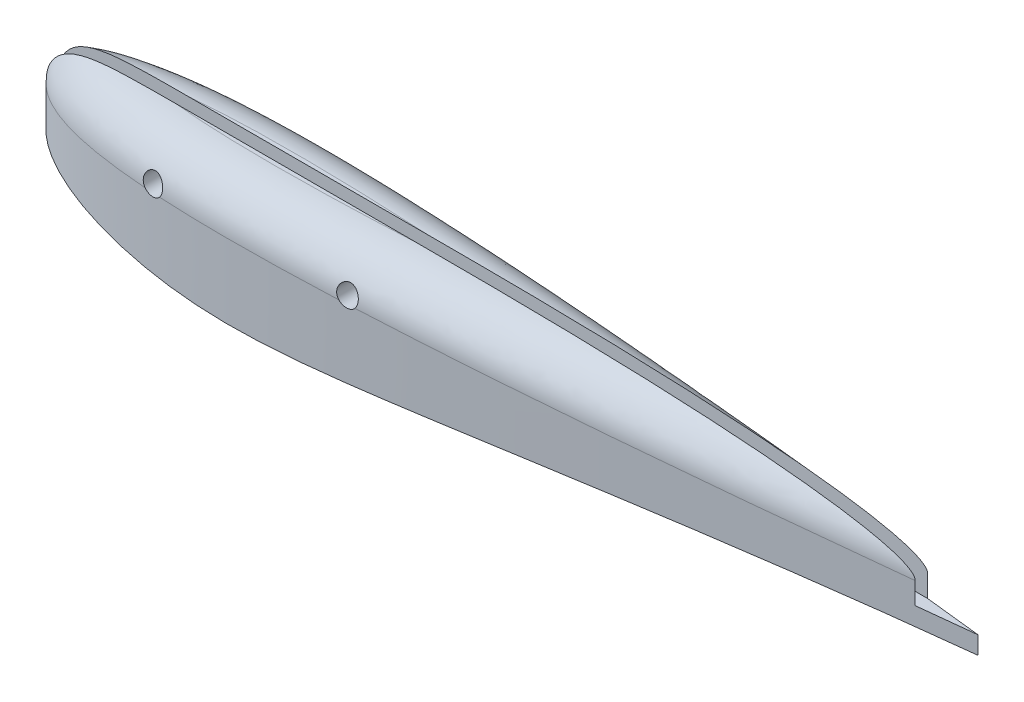
from build123d import *

# Parameters (mm, degrees)
BOSS_EXTRUDE1_DEPTH     = 20
CUT_EXTRUDE1_DEPTH      = 100
CUT_EXTRUDE1_DEPTH_BACK = 80
SKETCH2_R               = 9.525
FILLET1_R               = 7
CUT_EXTRUDE2_DEPTH      = 90
CUT_EXTRUDE2_DEPTH_BACK = 80
SKETCH3_W               = 2
SKETCH3_H               = 21
SKETCH4_R               = 1.1
CUT_EXTRUDE3_DEPTH      = 80
SKETCH5_R               = 1.65
CUT_EXTRUDE4_DEPTH      = 10


with BuildPart() as part:
    # Sketch1 → Boss-Extrude1 (new body)
    with BuildSketch(Plane(origin=(0, 0, 0), x_dir=(1, 0, 0), z_dir=(0, 1, 0))):
        with BuildLine():
            add(Edge.make_bspline(
                [(-69.417288603, 0), (-64.102368137, 8.438871324), (-45.488700864, 11.50648449), (-0.596238351, 9), (80.582711397, 0)],
                knots=[0, 0, 0, 0, 0, 1, 1, 1, 1, 1], degree=4))
            add(Edge.make_bspline(
                [(-69.417288603, 0), (-64.102368137, -8.438871324), (-45.488700864, -11.50648449), (-0.596238351, -9), (80.582711397, 0)],
                knots=[0, 0, 0, 0, 0, 1, 1, 1, 1, 1], degree=4))
        make_face()
    extrude(amount=BOSS_EXTRUDE1_DEPTH)

    # Sketch2 → Cut-Extrude1 (cut, two sides: drawn at the far end of the back side and taken through both)
    with BuildSketch(Plane(origin=(0, 0, 0), x_dir=(0, 0, -1), z_dir=(1, 0, 0)).offset(-CUT_EXTRUDE1_DEPTH_BACK)):
        with Locations((0, -2.900256299)):
            Circle(SKETCH2_R)
    extrude(amount=CUT_EXTRUDE1_DEPTH + CUT_EXTRUDE1_DEPTH_BACK, mode=Mode.SUBTRACT)

    # Fillet1
    fillet1_edges = [part.edges().sort_by_distance(p)[0] for p in [
        (4.643573397, 20, -7.185019948),
        (4.643573397, 20, 7.185019948),
    ]]
    fillet(fillet1_edges, radius=FILLET1_R)

    # Sketch3 → Cut-Extrude2 (cut, two sides: drawn at the far end of the back side and taken through both)
    with BuildSketch(Plane(origin=(0, 0, 0), x_dir=(0, 0, -1), z_dir=(1, 0, 0)).offset(-CUT_EXTRUDE2_DEPTH_BACK)):
        with Locations((0, 20)):
            Rectangle(SKETCH3_W, SKETCH3_H)
    extrude(amount=CUT_EXTRUDE2_DEPTH + CUT_EXTRUDE2_DEPTH_BACK, mode=Mode.SUBTRACT)

    # Sketch4 → Cut-Extrude3 (cut)
    with BuildSketch(Plane.XY.offset(10)):
        with Locations(Location((-44.287860139, 14.093519601, 0), (0, 0, 276.204126891))):
            Circle(SKETCH4_R)
        with Locations(Location((-13.003867008, 14.093519601, 0), (0, 0, 276.204127152))):
            Circle(SKETCH4_R)
    extrude(amount=-CUT_EXTRUDE3_DEPTH, mode=Mode.SUBTRACT)

    # Sketch5 → Cut-Extrude4 (cut)
    with BuildSketch(Plane.XY.offset(10)):
        with Locations(Location((-44.287860139, 14.093519601, 0), (0, 0, 318.490887793))):
            Circle(SKETCH5_R)
        with Locations(Location((-13.003867008, 14.093519601, 0), (0, 0, 318.490887793))):
            Circle(SKETCH5_R)
    extrude(amount=-CUT_EXTRUDE4_DEPTH, mode=Mode.SUBTRACT)


solid = part.part
